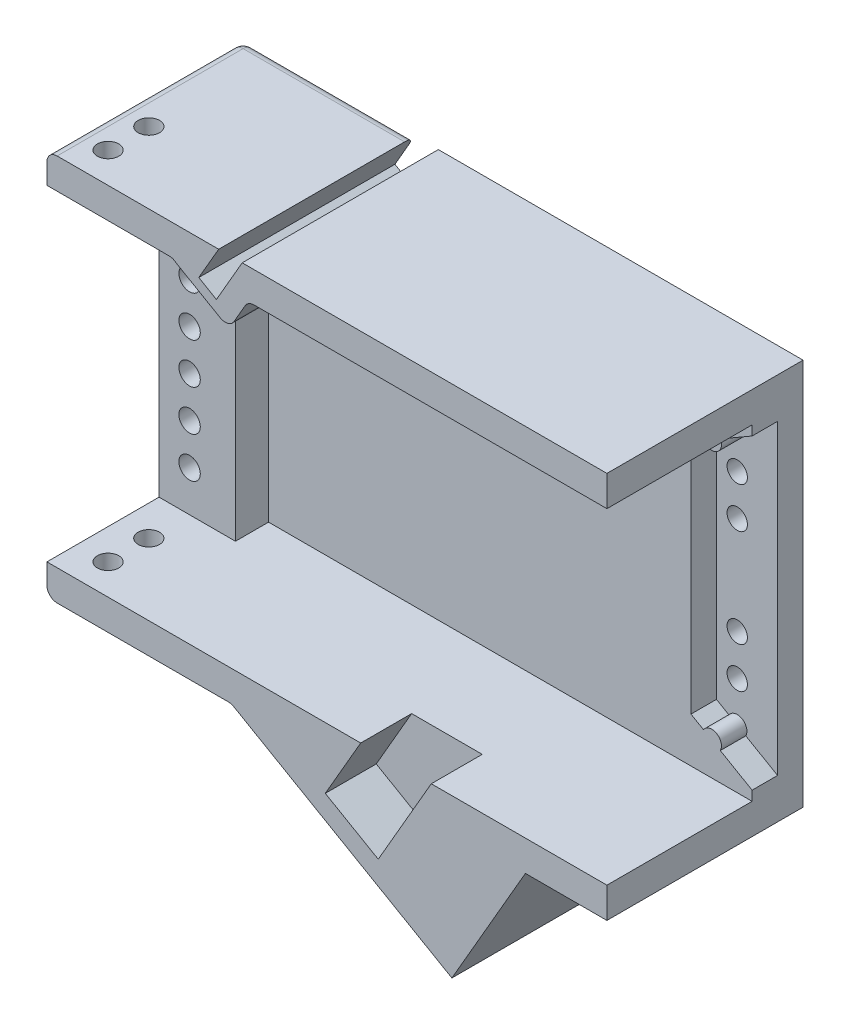
from build123d import *

# Parameters (mm, degrees)
SKETCH_2_W               = 109.92
SKETCH_2_H               = 76
EXTRUDE_1_DEPTH          = 10
CUT_EXTRUDE_1_DEPTH      = 5
SKETCH_4_R               = 2
CUT_EXTRUDE_2_DEPTH      = 92.808295873
SKETCH_5_W               = 109.92
SKETCH_5_H               = 6
EXTRUDE_2_DEPTH          = 28.5
SKETCH_6_W               = 15
SKETCH_6_H               = 64
EXTRUDE_3_DEPTH          = 6.5
CUT_EXTRUDE_3_DEPTH      = 105.577891178
CUT_EXTRUDE_3_DEPTH_BACK = 105.577891178
SKETCH_7_R               = 2.1
SKETCH_9_R               = 2.1
CUT_EXTRUDE_4_DEPTH      = 95.274934055
CUT_EXTRUDE_5_DEPTH      = 5
EXTRUDE_4_DEPTH          = 38.5
CUT_EXTRUDE_6_DEPTH      = 10
CUT_EXTRUDE_7_REACH      = 103.379
SKETCH_18_W              = 12
SKETCH_18_H              = 10
EXTRUDE_5_DEPTH          = 38.5
CUT_EXTRUDE_8_DEPTH      = 100.428432508
FILLET_1_R               = 2
SKETCH_23_R              = 1.8
CUT_EXTRUDE_10_DEPTH     = 8


with BuildPart() as part:
    # 草圖2 → 填料-伸長1 (new body)
    with BuildSketch(Plane.XY):
        with Locations((12.52544527, 24.044160626)):
            Rectangle(SKETCH_2_W, SKETCH_2_H)
    extrude(amount=EXTRUDE_1_DEPTH)

    # 草圖3 → 除料-伸長1 (cut)
    with BuildSketch(Plane.XY.offset(10)):
        with BuildLine():
            Line((67.48544527, -6.055839374), (67.48544527, 54.144160626))
            Line((67.48544527, 54.144160626), (61.24181631, 50.538464901))
            ThreePointArc((61.24181631, 50.538464901), (61.408690367, 50.105080914), (61.46544527, 49.644160626))
            ThreePointArc((61.46544527, 49.644160626), (60.088104264, 47.81746208), (57.95299519, 48.639170705))
            Line((57.95299519, 48.639170705), (55.48544527, 47.214160626))
            Line((55.48544527, 47.214160626), (55.48544527, 0.874160626))
            Line((55.48544527, 0.874160626), (57.95299519, -0.550849453))
            ThreePointArc((57.95299519, -0.550849453), (60.088104264, 0.270859171), (61.46544527, -1.555839374))
            ThreePointArc((61.46544527, -1.555839374), (61.408690367, -2.016759663), (61.24181631, -2.45014365))
            Line((61.24181631, -2.45014365), (67.48544527, -6.055839374))
        make_face()
    extrude(amount=-CUT_EXTRUDE_1_DEPTH, mode=Mode.SUBTRACT)

    # 草圖4 → 除料-伸長2 (cut, through all)
    with BuildSketch(Plane.XY.offset(5)):
        with Locations((59.56544527, 41.644160626)):
            Circle(SKETCH_4_R)
        with Locations((59.56544527, 33.644160626)):
            Circle(SKETCH_4_R)
        with Locations((59.56544527, 6.444160626)):
            Circle(SKETCH_4_R)
        with Locations((59.56544527, 14.444160626)):
            Circle(SKETCH_4_R)
    extrude(amount=-CUT_EXTRUDE_2_DEPTH, mode=Mode.SUBTRACT)

    # 草圖5 → 填料-伸長2 (add)
    with BuildSketch(Plane.XY.offset(10)):
        with Locations((12.52544527, -10.955839374)):
            Rectangle(SKETCH_5_W, SKETCH_5_H)
        with Locations((12.52544527, 59.044160626)):
            Rectangle(SKETCH_5_W, SKETCH_5_H)
    extrude(amount=EXTRUDE_2_DEPTH)

    # 草圖6 → 填料-伸長3 (add)
    with BuildSketch(Plane.XY.offset(10)):
        with Locations((-34.93455473, 24.044160626)):
            Rectangle(SKETCH_6_W, SKETCH_6_H)
    extrude(amount=EXTRUDE_3_DEPTH)

    # 草圖7 → 除料-伸長3 (cut, two sides: drawn at the far end of the back side and taken through both)
    with BuildSketch(Plane(origin=(0, -7.955839374, 0), x_dir=(1, 0, 0), z_dir=(0, 1, 0)).offset(-CUT_EXTRUDE_3_DEPTH_BACK)):
        with Locations(Location((-36.43455473, -24.5, 0), (0, 0, 270))):
            Circle(SKETCH_7_R)
        with Locations(Location((-36.43455473, -32.5, 0), (0, 0, 270))):
            Circle(SKETCH_7_R)
    extrude(amount=CUT_EXTRUDE_3_DEPTH + CUT_EXTRUDE_3_DEPTH_BACK, mode=Mode.SUBTRACT)

    # 草圖9 → 除料-伸長4 (cut, through all)
    with BuildSketch(Plane.XY.offset(16.5)):
        with Locations((-36.43455473, 0.044160626)):
            Circle(SKETCH_9_R)
        with Locations((-36.43455473, 8.044160626)):
            Circle(SKETCH_9_R)
        with Locations((-36.43455473, 16.044160626)):
            Circle(SKETCH_9_R)
        with Locations((-36.43455473, 24.044160626)):
            Circle(SKETCH_9_R)
        with Locations((-36.43455473, 32.044160626)):
            Circle(SKETCH_9_R)
        with Locations((-36.43455473, 40.044160626)):
            Circle(SKETCH_9_R)
        with Locations((-36.43455473, 48.044160626)):
            Circle(SKETCH_9_R)
    extrude(amount=-CUT_EXTRUDE_4_DEPTH, mode=Mode.SUBTRACT)

    # 草圖10 → 除料-伸長5 (cut)
    with BuildSketch(Plane(origin=(0, 0, 0), x_dir=(-1, 0, 0), z_dir=(0, 0, -1))):
        with BuildLine():
            Line((32.43455473, 0.044160626), (32.43455473, 48.044160626))
            ThreePointArc((32.43455473, 48.044160626), (36.43455473, 52.044160626), (40.43455473, 48.044160626))
            Line((40.43455473, 48.044160626), (40.43455473, 0.044160626))
            ThreePointArc((40.43455473, 0.044160626), (36.43455473, -3.955839374), (32.43455473, 0.044160626))
        make_face()
    extrude(amount=-CUT_EXTRUDE_5_DEPTH, mode=Mode.SUBTRACT)

    # 草圖11 → 填料-伸長4 (add)
    with BuildSketch(Plane(origin=(0, 0, 0), x_dir=(-1, 0, 0), z_dir=(0, 0, -1))):
        Polygon((6.249581649, -13.955839374), (-51.48544527, -13.955839374), (-37.05168854, -38.955839374), align=None)
    extrude(amount=-EXTRUDE_4_DEPTH)

    # 草圖17 → 除料-伸長6 (cut)
    with BuildSketch(Plane.XY.offset(38.5)):
        Polygon((22.597205868, -25.991737759), (12.204901023, -19.991737759), (16.704901023, -12.197509125), (27.097205868, -18.197509125), align=None)
    extrude(amount=-CUT_EXTRUDE_6_DEPTH, mode=Mode.SUBTRACT)

    # 草圖18 → 除料-伸長7 (cut, up to next)
    with BuildSketch(Plane(origin=(-1.105451127, -1.914697517, 0), x_dir=(0.8660254037844504, -0.49999999999997985, 0), z_dir=(-0.4999999999999798, -0.8660254037844503, 0)), mode=Mode.PRIVATE) as cut_extrude_7_sk1:
        with Locations((26.565623216, 33.5)):
            Rectangle(SKETCH_18_W, SKETCH_18_H)
    cut_extrude_7_tool1 = extrude(cut_extrude_7_sk1.sketch, amount=-CUT_EXTRUDE_7_REACH, mode=Mode.PRIVATE) & part.part
    add(cut_extrude_7_tool1.solids().sort_by_distance((21.901053, -15.197509, 33.5))[0], mode=Mode.SUBTRACT)

    # 草圖20 → 填料-伸長5 (add)
    with BuildSketch(Plane(origin=(0, 0, 0), x_dir=(-1, 0, 0), z_dir=(0, 0, -1))):
        Polygon((-0.512814044, 62.044160626), (6.701287571, 49.548970097), (17.093592417, 55.548970097), (13.343592417, 62.044160626), align=None)
    extrude(amount=-EXTRUDE_5_DEPTH)

    # 草圖21 → 除料-伸長8 (cut, through all)
    with BuildSketch(Plane.XY.offset(38.5)):
        Polygon((-4.10598811, 62.044160626), (-8.724790263, 62.044160626), (-12.629490801, 55.281020905), (-9.165389186, 53.281020905), align=None)
    extrude(amount=-CUT_EXTRUDE_8_DEPTH, mode=Mode.SUBTRACT)

    # 圓角1
    # the kernel refuses this fillet: 2 mm, written as the material it adds along each edge
    with BuildSketch(Plane(origin=(-6.249581649, -13.955839374, 0), x_dir=(-1, 0, 0), z_dir=(0, 0, 1))) as fillet_1_piece_1:
        with BuildLine():
            CenterArc((FILLET_1_R * 0.267949192431, FILLET_1_R), FILLET_1_R, 240, 30)
            Line((-FILLET_1_R * 0.232050807569, FILLET_1_R * 0.133974596216), (0, 0))
            Line((0, 0), (FILLET_1_R * 0.267949192431, 0))
        make_face()
    extrude(amount=38.5)
    with BuildSketch(Plane(origin=(-32.43455473, 56.044160626, 10), x_dir=(0, 0, 1), z_dir=(1, 0, 0))) as fillet_1_piece_2_section:
        with BuildLine():
            CenterArc((FILLET_1_R, FILLET_1_R), FILLET_1_R, 180, 90)
            Line((0, FILLET_1_R), (0, 0))
            Line((0, 0), (FILLET_1_R, 0))
        make_face()
    fillet_1_piece_2 = extrude(amount=20.626860698, mode=Mode.PRIVATE)
    fillet_1_piece_2 = split(fillet_1_piece_2, bisect_by=Plane(origin=(-27.81373794, 64.047650078, 10), z_dir=(-0.5000000000000001, -0.8660254037844386, 0)), keep=Keep.TOP, mode=Mode.PRIVATE)
    add(fillet_1_piece_2)
    with BuildSketch(Plane(origin=(-2.951287571, 56.044160626, 38.5), x_dir=(1, 0, 0), z_dir=(0, 0, -1))) as fillet_1_piece_3:
        with BuildLine():
            CenterArc((FILLET_1_R * 0.57735026919, FILLET_1_R), FILLET_1_R, 210, 60)
            Line((-FILLET_1_R * 0.288675134595, FILLET_1_R * 0.5), (0, 0))
            Line((0, 0), (FILLET_1_R * 0.57735026919, 0))
        make_face()
    extrude(amount=31.386751346)
    with BuildSketch(Plane(origin=(-16.807694032, 56.044160626, 5.991748635), x_dir=(-0.5000000000023799, -0.8660254037830647, 0), z_dir=(0, 0, 1))) as fillet_1_piece_4:
        with BuildLine():
            CenterArc((2.533701081, -0.388499003), FILLET_1_R, 168.799115107, 41.200884893)
            Line((0.801650273, -1.388499003), (0, 0))
            Line((0, 0), (0.57179677, 0))
        make_face()
    extrude(amount=32.508251365)
    # the kernel refuses this fillet: 2 mm, written as the material it takes off along each edge
    with BuildSketch(Plane(origin=(-40.43455473, 60.044160626, 2), x_dir=(0, 0, -1), z_dir=(0, 1, 0))) as fillet_1_2_piece_1_section:
        Polygon((0, 0), (FILLET_1_R * 1.02, 0), (FILLET_1_R * 1.02, FILLET_1_R * 1.02), (0, FILLET_1_R * 1.02), align=None)
    fillet_1_2_piece_1 = extrude(amount=FILLET_1_R * 1.02, mode=Mode.PRIVATE)
    fillet_1_2_piece_1 = fillet_1_2_piece_1 - Plane(origin=(-40.43455473, 60.044160626, 2), x_dir=(0.7071067811865475, 0, 0.7071067811865475), z_dir=(0, 1, 0)) * Sphere(FILLET_1_R, mode=Mode.PRIVATE)
    add(fillet_1_2_piece_1, mode=Mode.SUBTRACT)
    with BuildSketch(Plane(origin=(-42.43455473, -13.955839374, -5), x_dir=(1, 0, 0), z_dir=(0, 0, 1))) as fillet_1_2_piece_2:
        with BuildLine():
            CenterArc((FILLET_1_R, FILLET_1_R), FILLET_1_R, 180, 90)
            Line((0, FILLET_1_R), (0, 0))
            Line((0, 0), (FILLET_1_R, 0))
        make_face()
    extrude(amount=48.5, mode=Mode.SUBTRACT)
    with BuildSketch(Plane(origin=(-42.43455473, 62.044160626, 2), x_dir=(1, 0, 0), z_dir=(0, 0, 1))) as fillet_1_2_piece_3:
        with BuildLine():
            CenterArc((FILLET_1_R, -FILLET_1_R), FILLET_1_R, 90, 90)
            Line((0, -FILLET_1_R), (0, 0))
            Line((0, 0), (FILLET_1_R, 0))
        make_face()
    extrude(amount=41.5, mode=Mode.SUBTRACT)
    with BuildSketch(Plane(origin=(-42.43455473, -18.955839374, 0), x_dir=(0, 0, 1), z_dir=(0, 1, 0))) as fillet_1_2_piece_4:
        with BuildLine():
            CenterArc((FILLET_1_R, FILLET_1_R), FILLET_1_R, 180, 90)
            Line((0, FILLET_1_R), (0, 0))
            Line((0, 0), (FILLET_1_R, 0))
        make_face()
    extrude(amount=79, mode=Mode.SUBTRACT)
    with BuildSketch(Plane(origin=(-6.701287571, 49.548970097, 10), x_dir=(-0.8660254037844417, 0.4999999999999948, 0), z_dir=(0, 0, 1))) as fillet_1_2_piece_5:
        with BuildLine():
            CenterArc((FILLET_1_R, -FILLET_1_R), FILLET_1_R, 90, 90)
            Line((0, -FILLET_1_R), (0, 0))
            Line((0, 0), (FILLET_1_R, 0))
        make_face()
    extrude(amount=33.5, mode=Mode.SUBTRACT)
    with BuildSketch(Plane(origin=(-3.724790263, 62.044160626, 0), x_dir=(0, 0, 1), z_dir=(-1, 0, 0))) as fillet_1_2_piece_6_section:
        with BuildLine():
            CenterArc((FILLET_1_R, -FILLET_1_R), FILLET_1_R, 90, 90)
            Line((0, -FILLET_1_R), (0, 0))
            Line((0, 0), (FILLET_1_R, 0))
        make_face()
    fillet_1_2_piece_6 = extrude(amount=36.709764467, mode=Mode.PRIVATE)
    fillet_1_2_piece_6 = split(fillet_1_2_piece_6, bisect_by=Plane(origin=(-7.474790263, 64.209224135, 0), z_dir=(-0.8660254037844323, 0.500000000000011, 0)), keep=Keep.TOP, mode=Mode.PRIVATE)
    add(fillet_1_2_piece_6, mode=Mode.SUBTRACT)
    # the kernel refuses this fillet: 2 mm, written as the material it takes off along each edge
    with BuildSketch(Plane(origin=(-40.43455473, -11.955839374, 2), x_dir=(0, -1, 0), z_dir=(0, 0, -1))) as fillet_1_3_piece_1_section:
        Polygon((0, 0), (FILLET_1_R * 1.02, 0), (FILLET_1_R * 1.02, FILLET_1_R * 1.02), (0, FILLET_1_R * 1.02), align=None)
    fillet_1_3_piece_1 = extrude(amount=FILLET_1_R * 1.02, mode=Mode.PRIVATE)
    fillet_1_3_piece_1 = fillet_1_3_piece_1 - Plane(origin=(-40.43455473, -11.955839374, 2), x_dir=(0.7071067811865475, 0.7071067811865475, 0), z_dir=(0, 0, -1)) * Sphere(FILLET_1_R, mode=Mode.PRIVATE)
    add(fillet_1_3_piece_1, mode=Mode.SUBTRACT)
    with BuildSketch(Plane(origin=(-6.785480034, -13.955839374, 0), x_dir=(0, 1, 0), z_dir=(-1, 0, 0))) as fillet_1_3_piece_2:
        with BuildLine():
            CenterArc((FILLET_1_R, -FILLET_1_R), FILLET_1_R, 90, 90)
            Line((0, -FILLET_1_R), (0, 0))
            Line((0, 0), (FILLET_1_R, 0))
        make_face()
    extrude(amount=33.649074696, mode=Mode.SUBTRACT)
    with BuildSketch(Plane(origin=(41.381815559, -41.455839374, 0), x_dir=(0.499999999999995, 0.8660254037844416, 0), z_dir=(-0.8660254037844416, 0.49999999999999506, 0))) as fillet_1_3_piece_3:
        with BuildLine():
            CenterArc((FILLET_1_R, -FILLET_1_R), FILLET_1_R, 90, 90)
            Line((0, -FILLET_1_R), (0, 0))
            Line((0, 0), (FILLET_1_R, 0))
        make_face()
    extrude(amount=54.464101615, mode=Mode.SUBTRACT)
    with BuildSketch(Plane(origin=(-6.785480034, -15.955839374, 0), x_dir=(0, 1, 0), z_dir=(-1, 0, 0))) as fillet_1_3_piece_4:
        with BuildLine():
            CenterArc((2 + FILLET_1_R, -FILLET_1_R), FILLET_1_R, 90, 90)
            Line((2, -FILLET_1_R), (2, 0))
            Line((2, 0), (2 + FILLET_1_R, 0))
        make_face()
    revolve(axis=Axis((-6.785480034, -15.955839374, 0), (0, 0, -1)), revolution_arc=30, mode=Mode.SUBTRACT)

    # 草圖23 → 除料-伸長10 (cut)
    with BuildSketch(Plane(origin=(0, 0, 0), x_dir=(-1, 0, 0), z_dir=(0, 0, -1))):
        with Locations((-26.945451548, -19.849806604)):
            Circle(SKETCH_23_R)
        with Locations((-15.636890672, -8.530952823)):
            Circle(SKETCH_23_R)
        with Locations((-4.328329796, 2.787900958)):
            Circle(SKETCH_23_R)
        with Locations((6.990523985, -8.520659918)):
            Circle(SKETCH_23_R)
    extrude(amount=-CUT_EXTRUDE_10_DEPTH, mode=Mode.SUBTRACT)


solid = part.part
